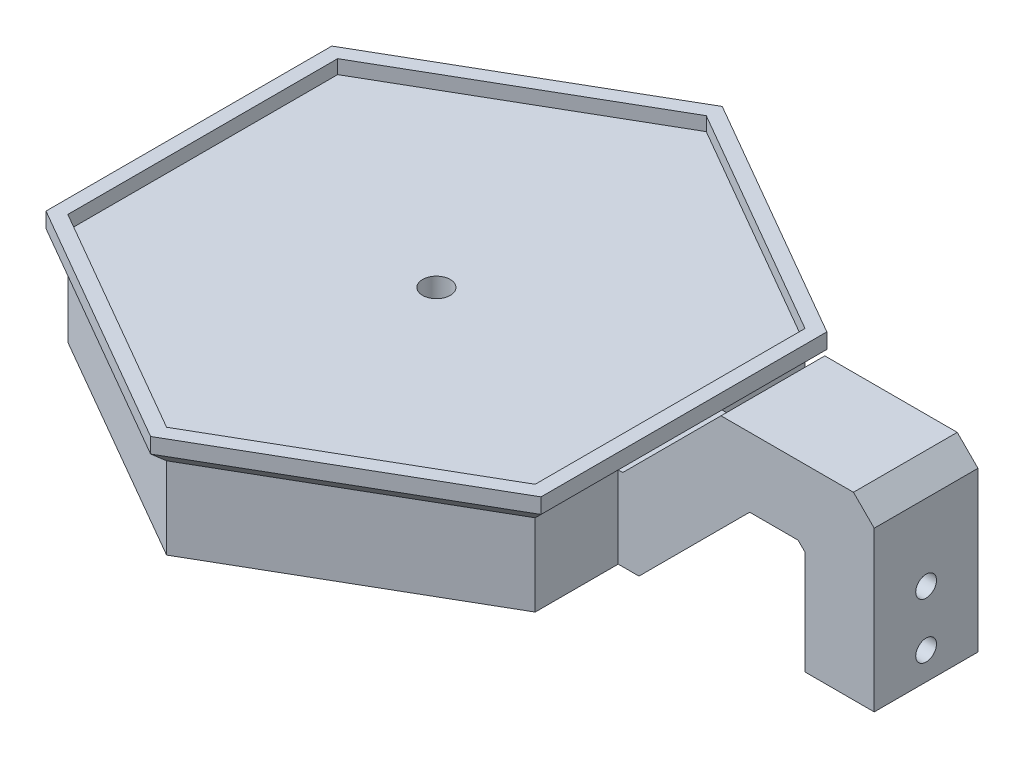
from build123d import *

# Parameters (mm, degrees)
BOSS_EXTRUDE1_DEPTH      = 14
BOSS_EXTRUDE2_DEPTH      = 2
BOSS_EXTRUDE2_DEPTH_BACK = 0.2
CHAMFER1_SIZE            = 2
SKETCH3_R                = 2
CUT_EXTRUDE1_DEPTH       = 57.412025139
BOSS_EXTRUDE3_DEPTH      = 7.5
CUT_EXTRUDE2_REACH       = 110.187
SKETCH6_R                = 1.5
CHAMFER2_SIZE            = 1
CHAMFER3_SIZE            = 3


with BuildPart() as part:
    # Sketch1 → Boss-Extrude1 (new body)
    with BuildSketch(Plane(origin=(0, 0, 0), x_dir=(1, 0, 0), z_dir=(0, 1, 0))):
        Polygon((33.774990748, 19.5), (0, 39), (-33.774990748, 19.5), (-33.774990748, -19.5), (0, -39), (33.774990748, -19.5), align=None)
    extrude(amount=BOSS_EXTRUDE1_DEPTH)

    # Sketch2 → Boss-Extrude2 (add, two sides: drawn at the far end of the back side and taken through both)
    with BuildSketch(Plane(origin=(0, 14, 0), x_dir=(1, 0, 0), z_dir=(0, 1, 0)).offset(-BOSS_EXTRUDE2_DEPTH_BACK)):
        Polygon((0, 41.309401077), (-35.774990748, 20.654700538), (-35.774990748, -20.654700538), (0, -41.309401077), (35.774990748, -20.654700538), (35.774990748, 20.654700538), align=None)
        Polygon((33.774990748, -19.5), (33.774990748, 19.5), (0, 39), (-33.774990748, 19.5), (-33.774990748, -19.5), (0, -39), align=None, mode=Mode.SUBTRACT)
    extrude(amount=BOSS_EXTRUDE2_DEPTH + BOSS_EXTRUDE2_DEPTH_BACK)

    # Chamfer1
    chamfer1_edges = [part.edges().sort_by_distance(p)[0] for p in [
        (-16.887495374, 13.8, 29.25),
        (16.887495374, 13.8, 29.25),
        (33.774990748, 13.8, 0),
        (16.887495374, 13.8, -29.25),
        (-16.887495374, 13.8, -29.25),
        (-33.774990748, 13.8, 0),
    ]]
    chamfer(chamfer1_edges, length=CHAMFER1_SIZE - 0.0001)  # a hair under: the kernel refuses the full size

    # Sketch3 → Cut-Extrude1 (cut, through all)
    with BuildSketch(Plane(origin=(0, 14, 0), x_dir=(1, 0, 0), z_dir=(0, 1, 0))):
        with Locations(Location((0, 0, 0), (0, 0, 270))):
            Circle(SKETCH3_R)
    extrude(amount=-CUT_EXTRUDE1_DEPTH, mode=Mode.SUBTRACT)

    # Sketch5 → Boss-Extrude3 (add, symmetric)
    with BuildSketch(Plane.XY):
        Polygon((33.774990748, 11.8), (34.432855124, 11.8), (48.632855124, 26), (70.774990748, 26), (70.774990748, 0), (60.774990748, 0), (60.774990748, 16), (52.774990748, 16), (36.774990748, 0), (33.774990748, 0), align=None)
    extrude(amount=BOSS_EXTRUDE3_DEPTH, both=True)

    # Sketch6 → Cut-Extrude2 (cut, up to next)
    with BuildSketch(Plane.ZY.offset(-60.774990748), mode=Mode.PRIVATE) as cut_extrude2_sk1:
        with Locations(Location((0, 12, 0), (0, 0, 270))):
            Circle(SKETCH6_R)
    cut_extrude2_tool1 = extrude(cut_extrude2_sk1.sketch, amount=-CUT_EXTRUDE2_REACH, mode=Mode.PRIVATE) & part.part
    # Sketch6 → Cut-Extrude2 (cut, up to next)
    with BuildSketch(Plane.ZY.offset(-60.774990748), mode=Mode.PRIVATE) as cut_extrude2_sk2:
        with Locations(Location((0, 4, 0), (0, 0, 270))):
            Circle(SKETCH6_R)
    cut_extrude2_tool2 = extrude(cut_extrude2_sk2.sketch, amount=-CUT_EXTRUDE2_REACH, mode=Mode.PRIVATE) & part.part
    add(cut_extrude2_tool1.solids().sort_by_distance((60.774991, 12, 0))[0], mode=Mode.SUBTRACT)
    add(cut_extrude2_tool2.solids().sort_by_distance((60.774991, 4, 0))[0], mode=Mode.SUBTRACT)

    # Chamfer2
    chamfer2_edges = [part.edges().sort_by_distance(p)[0] for p in [
        (60.774990748, 16, 0),
    ]]
    chamfer(chamfer2_edges, length=CHAMFER2_SIZE)

    # Chamfer3
    chamfer3_edges = [part.edges().sort_by_distance(p)[0] for p in [
        (70.774990748, 26, 0),
    ]]
    chamfer(chamfer3_edges, length=CHAMFER3_SIZE)


solid = part.part
